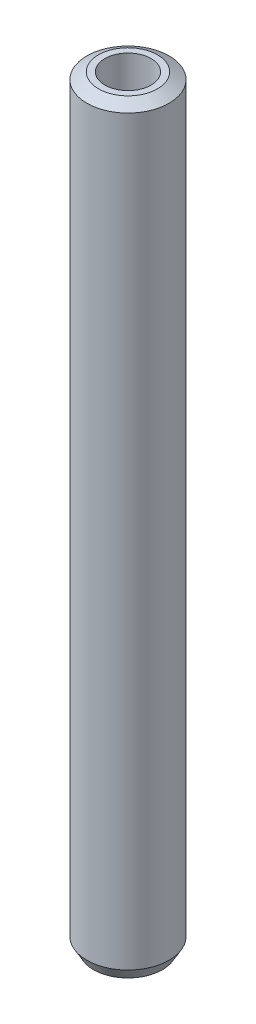
from build123d import *
from OCP.BRepFilletAPI import BRepFilletAPI_MakeChamfer

# Parameters (mm, degrees)
SKETCH1_R           = 20
BOSS_EXTRUDE1_DEPTH = 370.122258467
SKETCH2_R           = 11.224566923
CUT_EXTRUDE1_DEPTH  = 372.201409228
CHAMFER1_SIZE       = 3.259027688
CHAMFER1_SIZE2      = 5.644801539


with BuildPart() as part:
    # Sketch1 → Boss-Extrude1 (new body)
    with BuildSketch(Plane(origin=(0, 0, 0), x_dir=(1, 0, 0), z_dir=(0, 1, 0))):
        Circle(SKETCH1_R)
    extrude(amount=BOSS_EXTRUDE1_DEPTH)

    # Sketch2 → Cut-Extrude1 (cut, through all)
    with BuildSketch(Plane(origin=(0, 0, 0), x_dir=(1, 0, 0), z_dir=(0, 1, 0))):
        Circle(SKETCH2_R)
    extrude(amount=CUT_EXTRUDE1_DEPTH, mode=Mode.SUBTRACT)

    # Chamfer1: one chamfer whose edges measure the first distance from different faces: ONE call of the kernel's chamfer builder (chamfer() names one face for all edges)
    chamfer1_edges_1 = [part.edges().sort_by_distance(p)[0] for p in [
        (-20, 370.122258467, 0),
    ]]
    chamfer1_side_1 = [part.faces().sort_by_distance(p)[0] for p in [
        (-20, 185.061129233, 0),
    ]]
    chamfer1_edges_2 = [part.edges().sort_by_distance(p)[0] for p in [
        (-20, 0, 0),
    ]]
    chamfer1_side_2 = [part.faces().sort_by_distance(p)[0] for p in [
        (-19.434314575, 0, 0),
    ]]
    chamfer1 = BRepFilletAPI_MakeChamfer(part.part.solid().wrapped)
    for e in chamfer1_edges_1:
        chamfer1.Add(CHAMFER1_SIZE, CHAMFER1_SIZE2, e.wrapped, chamfer1_side_1[0].wrapped)  # the first distance lies on this face
    for e in chamfer1_edges_2:
        chamfer1.Add(CHAMFER1_SIZE, CHAMFER1_SIZE2, e.wrapped, chamfer1_side_2[0].wrapped)  # the first distance lies on this face
    add(Compound.cast(chamfer1.Shape()), mode=Mode.REPLACE)


solid = part.part
